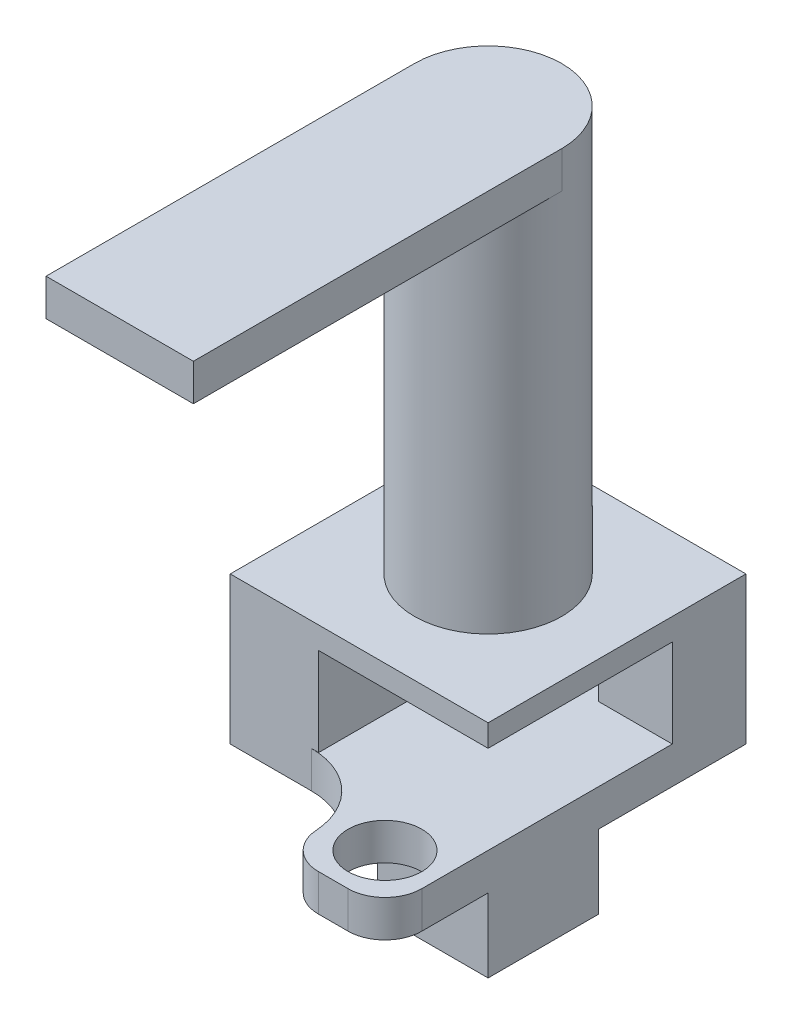
from build123d import *

# Parameters (mm, degrees)
SKETCH1_R           = 5
BOSS_EXTRUDE1_DEPTH = 5
BOSS_EXTRUDE2_DEPTH = 10
SKETCH3_W           = 12
SKETCH3_H           = 12
SKETCH3_W_2         = 10
SKETCH3_H_2         = 10
BOSS_EXTRUDE3_DEPTH = 12
SKETCH4_W           = 35
SKETCH4_H           = 35
BOSS_EXTRUDE4_DEPTH = 3
SKETCH5_R           = 10
BOSS_EXTRUDE5_DEPTH = 50
BOSS_EXTRUDE6_DEPTH = 5
FILLET1_R           = 10
FILLET4_R           = 5


with BuildPart() as part:
    # Sketch1 → Boss-Extrude1 (new body)
    with BuildSketch(Plane(origin=(0, 0, 0), x_dir=(1, 0, 0), z_dir=(0, 1, 0))):
        Polygon((0, 0), (0, 35), (35, 35), (35, 0), (35, -14), (21, -14), (21, 0), align=None)
        with Locations(Location((28, -7, 0), (0, 0, 270))):
            Circle(SKETCH1_R, mode=Mode.SUBTRACT)
        with BuildLine():
            Line((5.28246111, 33.217874153), (18.706396214, 18.392289297))
            ThreePointArc((18.706396214, 18.392289297), (18.531189995, 14.861099302), (15, 15.036305521))
            Line((15, 15.036305521), (1.576064896, 29.861890377))
            ThreePointArc((1.576064896, 29.861890377), (1.751271115, 33.393080372), (5.28246111, 33.217874153))
        make_face(mode=Mode.SUBTRACT)
    extrude(amount=BOSS_EXTRUDE1_DEPTH)

    # Sketch2 → Boss-Extrude2 (add)
    with BuildSketch(Plane.XZ):
        Polygon((30, -5), (20, -5), (20, 0), (35, 0), (35, -15), (30, -15), align=None)
    extrude(amount=BOSS_EXTRUDE2_DEPTH)

    # Sketch3 → Boss-Extrude3 (add)
    with BuildSketch(Plane(origin=(0, 5, 0), x_dir=(1, 0, 0), z_dir=(0, 1, 0))):
        with Locations((6, 6)):
            Rectangle(SKETCH3_W, SKETCH3_H)
        with Locations((30, 30)):
            Rectangle(SKETCH3_W_2, SKETCH3_H_2)
    extrude(amount=BOSS_EXTRUDE3_DEPTH)

    # Sketch4 → Boss-Extrude4 (add)
    with BuildSketch(Plane(origin=(0, 17, 0), x_dir=(1, 0, 0), z_dir=(0, 1, 0))):
        with Locations((17.5, 17.5)):
            Rectangle(SKETCH4_W, SKETCH4_H)
    extrude(amount=BOSS_EXTRUDE4_DEPTH)

    # Sketch5 → Boss-Extrude5 (add)
    with BuildSketch(Plane(origin=(0, 20, 0), x_dir=(1, 0, 0), z_dir=(0, 1, 0))):
        with Locations(Location((17.5, 17.5, 0), (0, 0, 270))):
            Circle(SKETCH5_R)
    extrude(amount=BOSS_EXTRUDE5_DEPTH)

    # Sketch6 → Boss-Extrude6 (add)
    with BuildSketch(Plane(origin=(0, 70, 0), x_dir=(1, 0, 0), z_dir=(0, 1, 0))):
        with BuildLine():
            Line((7.5, 17.5), (7.5, -32.5))
            Line((7.5, -32.5), (27.5, -32.5))
            Line((27.5, -32.5), (27.5, 17.5))
            ThreePointArc((27.5, 17.5), (17.5, 27.5), (7.5, 17.5))
        make_face()
    extrude(amount=BOSS_EXTRUDE6_DEPTH)

    # Fillet1
    # the kernel refuses this fillet: 10 mm, written as the material it adds along each edge
    with BuildSketch(Plane(origin=(21, 0, 0), x_dir=(-1, 0, 0), z_dir=(0, 1, 0))) as fillet1_piece_1:
        with BuildLine():
            CenterArc((FILLET1_R, FILLET1_R), FILLET1_R, 180, 90)
            Line((0, FILLET1_R), (0, 0))
            Line((0, 0), (FILLET1_R, 0))
        make_face()
    extrude(amount=5)

    # Fillet4
    fillet4_edges = [part.edges().sort_by_distance(p)[0] for p in [
        (35, 2.5, 14),
        (21, 2.5, 14),
    ]]
    fillet(fillet4_edges, radius=FILLET4_R)


solid = part.part
